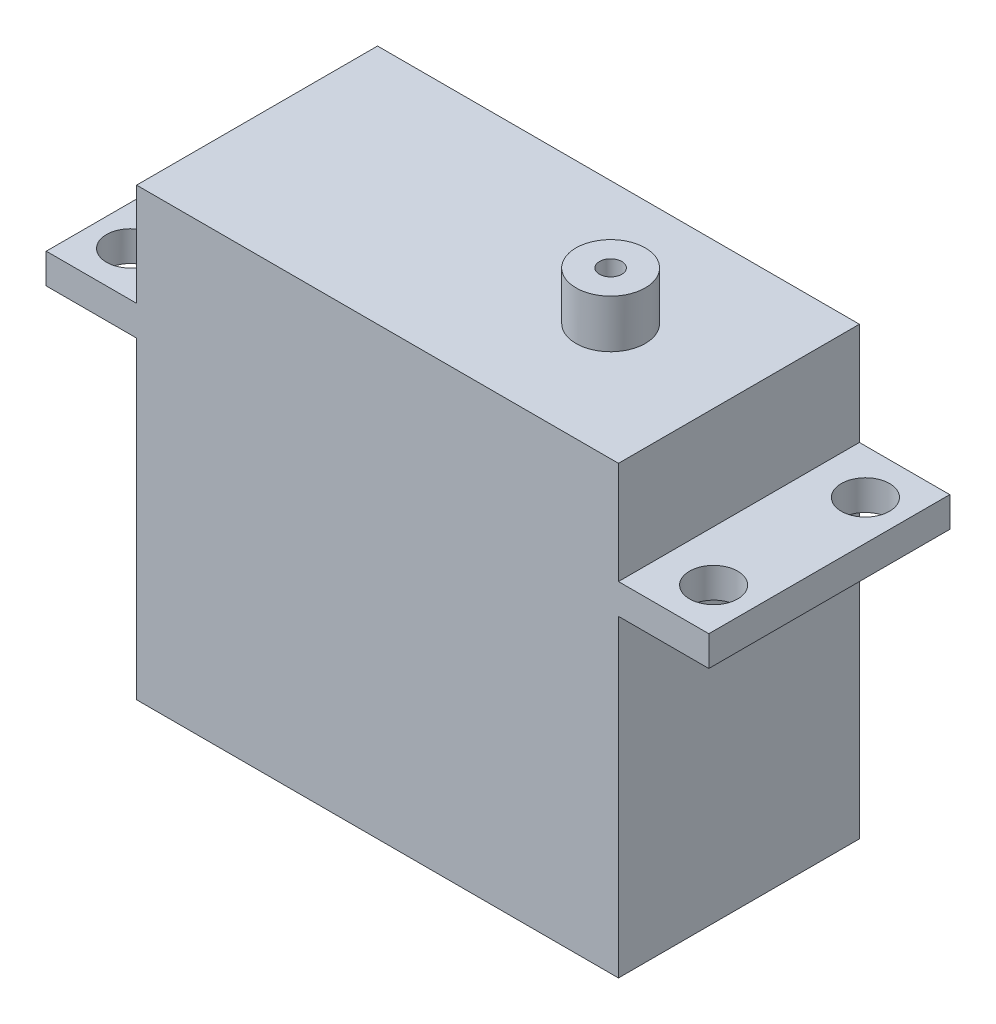
from build123d import *

# Parameters (mm, degrees)
SKETCH1_W              = 40
SKETCH1_H              = 20
BODY_DEPTH             = 37
SKETCH2_W              = 7.5
SKETCH2_H              = 20
FLANGES_DEPTH          = 2.5
FLANGE_HOLES_D         = 4
SKETCH5_R              = 2.875
AXLE_DEPTH             = 4
AXLE_CENTER_HOLE_D     = 1.85
AXLE_CENTER_HOLE_DEPTH = 4
AXLE_CENTER_HOLE_TIP   = 0.555796073


with BuildPart() as part:
    # Sketch1 → Body (new body)
    with BuildSketch(Plane(origin=(0, 0, 0), x_dir=(1, 0, 0), z_dir=(0, 1, 0))):
        Rectangle(SKETCH1_W, SKETCH1_H)
    extrude(amount=BODY_DEPTH)

    # Sketch2 → Flanges (add)
    with BuildSketch(Plane(origin=(0, 26, 0), x_dir=(1, 0, 0), z_dir=(0, 1, 0))):
        with Locations((23.75, 0)):
            Rectangle(SKETCH2_W, SKETCH2_H)
        with Locations((-23.75, 0)):
            Rectangle(SKETCH2_W, SKETCH2_H)
    extrude(amount=FLANGES_DEPTH)

    # Flange Holes (through all)
    with Locations(Plane(origin=(0, 28.5, 0), x_dir=(1, 0, 0), z_dir=(0, 1, 0))):
        with Locations((-24.2, -6.3), (-24.2, 6.3), (24.2, 6.3), (24.2, -6.3)):
            Hole(FLANGE_HOLES_D / 2)

    # Sketch5 → Axle (add)
    with BuildSketch(Plane(origin=(0, 37, 0), x_dir=(1, 0, 0), z_dir=(0, 1, 0))):
        with Locations((9.625, -0.275)):
            Circle(SKETCH5_R)
    extrude(amount=AXLE_DEPTH)

    # Axle Center Hole
    with Locations(Plane(origin=(0, 41, 0), x_dir=(1, 0, 0), z_dir=(0, 1, 0))):
        with Locations((9.625, -0.275)):
            Hole(AXLE_CENTER_HOLE_D / 2, depth=AXLE_CENTER_HOLE_DEPTH)
            with Locations((0, 0, -(AXLE_CENTER_HOLE_DEPTH + AXLE_CENTER_HOLE_TIP / 2))):  # 118° drill point
                Cone(0, AXLE_CENTER_HOLE_D / 2, AXLE_CENTER_HOLE_TIP, mode=Mode.SUBTRACT)


solid = part.part
